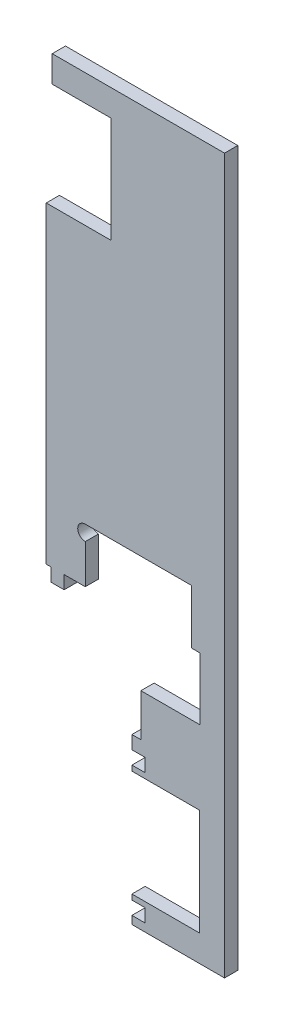
from build123d import *

# Parameters (mm, degrees)
BOSS_EXTRU_1_DEPTH      = 5
ESQUISSE2_R             = 2.8575
ENL_V_MAT_EXTRU_1_DEPTH = 5
ESQUISSE3_W             = 5
ESQUISSE3_H             = 5
BOSS_EXTRU_2_DEPTH      = 5


with BuildPart() as part:
    # Esquisse1 → Boss.-Extru.1 (new body)
    with BuildSketch(Plane.XY):
        Polygon((65.121094869, 0), (30.122364869, 0), (30.122364869, 3), (35.122364869, 3), (35.122364869, 8), (30.122364869, 8), (30.122364869, 10), (55.617614869, 10), (55.617614869, 50.2), (30.122364869, 50.2), (30.122364869, 52.2), (35.122364869, 52.2), (35.122364869, 57.2), (30.122364869, 57.2), (30.122364869, 62.2), (33.512280837, 62.2), (33.512280837, 78.240708175), (55.911629737, 78.240708175), (55.911629737, 101.750434868), (52.693, 101.750434868), (52.693, 122.246954868), (12.493, 122.246954868), (12.493, 101.750434868), (-2.259546173, 101.750434868), (-2.259546173, 220), (22.181004149, 220), (22.181004149, 260), (0, 260), (0, 270), (65.121094869, 270), align=None)
    extrude(amount=-BOSS_EXTRU_1_DEPTH)

    # Esquisse2 → Enlèv. mat.-Extru.1 (cut)
    with BuildSketch(Plane.XY):
        with Locations((12.493, 119.389454868)):
            Circle(ESQUISSE2_R)
    extrude(amount=-ENL_V_MAT_EXTRU_1_DEPTH, mode=Mode.SUBTRACT)

    # Esquisse3 → Boss.-Extru.2 (add)
    with BuildSketch(Plane.XY):
        with Locations((1.993, 99.250434868)):
            Rectangle(ESQUISSE3_W, ESQUISSE3_H)
    extrude(amount=-BOSS_EXTRU_2_DEPTH)


solid = part.part
